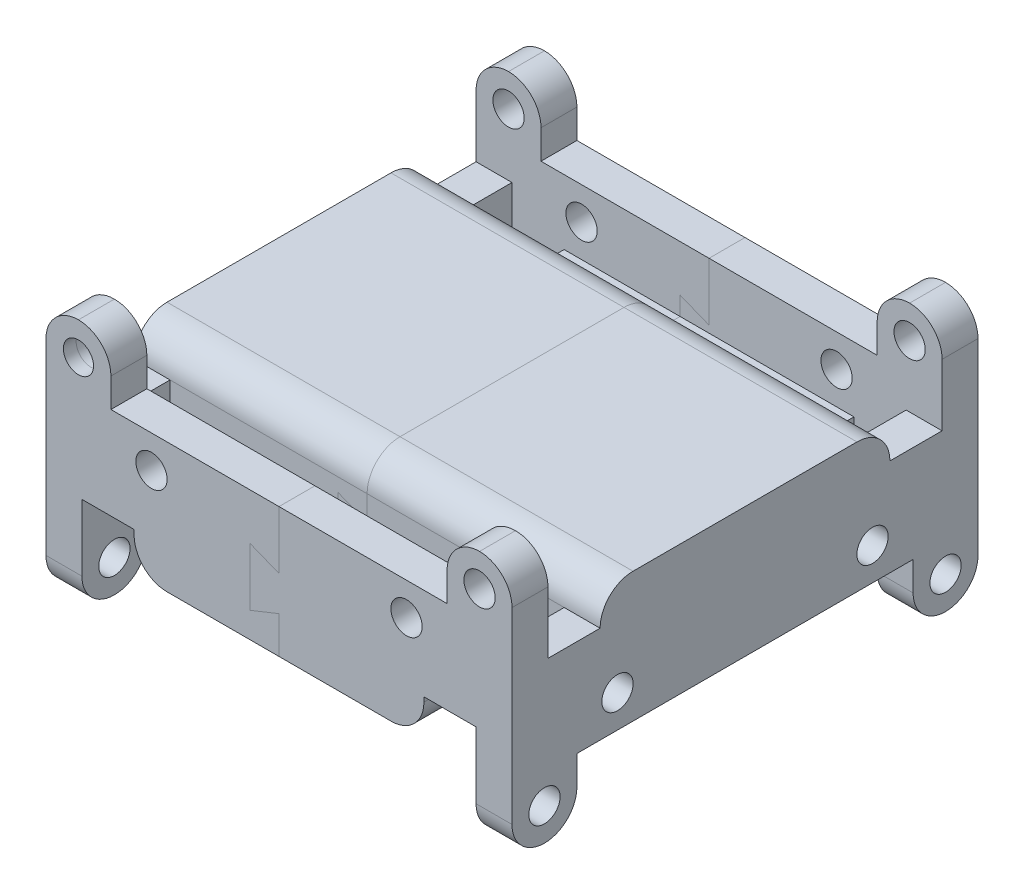
from build123d import *

# Parameters (mm, degrees)
ESBO_O1_R                  = 1.35
RESSALTO_EXTRUS_O1_DEPTH   = 2
ESBO_O3_W                  = 40.2
ESBO_O3_H                  = 2
RESSALTO_EXTRUS_O2_DEPTH   = 10.08
ESBO_O4_W                  = 3.1
ESBO_O4_H                  = 12.84
RESSALTO_EXTRUS_O3_DEPTH   = 34
CORTE_EXTRUS_O1_DEPTH      = 55.735280213
CORTE_EXTRUS_O1_DEPTH_BACK = 55.735280213
ESBO_O5_R                  = 1.35
ESBO_O7_W                  = 37.1
ESBO_O7_H                  = 3.24
CORTE_EXTRUS_O2_DEPTH      = 2
RESSALTO_EXTRUS_O5_START   = 2
ESBO_O12_R                 = 1.35
RESSALTO_EXTRUS_O5_DEPTH   = 2
ESBO_O18_W                 = 3.1
ESBO_O18_H                 = 3.24
RESSALTO_EXTRUS_O6_DEPTH   = 2
ESBO_O19_W                 = 3.1
ESBO_O19_H                 = 3.24
RESSALTO_EXTRUS_O7_DEPTH   = 2
ESBO_O21_R                 = 1.301764144
ESBO_O21_R_2               = 1.35
RESSALTO_EXTRUS_O8_DEPTH   = 1.1
RESSALTO_EXTRUS_O9_START   = 1.1
ESBO_O22_R                 = 1.35
RESSALTO_EXTRUS_O9_DEPTH   = 1.1
ESBO_O23_W                 = 3.1
ESBO_O23_H                 = 5.6
RESSALTO_EXTRUS_O10_DEPTH  = 5.85
CORTE_EXTRUS_O3_REACH      = 63.173
ESBO_O24_R                 = 1.35
ESBO_O25_W                 = 4.5
ESBO_O25_H                 = 3.1
CORTE_EXTRUS_O6_DEPTH      = 4.48
ESBO_O27_W                 = 3.1
ESBO_O27_H                 = 29
CORTE_EXTRUS_O7_DEPTH      = 4.48
ESBO_O28_W                 = 25
ESBO_O28_H                 = 40.2
CORTE_EXTRUS_O8_DEPTH      = 1.24
ESBO_O29_W                 = 25
ESBO_O29_H                 = 5.6
RESSALTO_EXTRUS_O11_DEPTH  = 34
ESBO_O31_W                 = 3.1
ESBO_O31_H                 = 25
RESSALTO_EXTRUS_O12_DEPTH  = 2.84
ESBO_O32_W                 = 25
ESBO_O32_H                 = 5.6
RESSALTO_EXTRUS_O13_DEPTH  = 34
FILETE1_R                  = 2.84
ESBO_O33_W                 = 5.6
ESBO_O33_H                 = 3.1
CORTE_EXTRUS_O9_DEPTH      = 0.55
ESBO_O35_W                 = 3.1
ESBO_O35_H                 = 5.6
CORTE_EXTRUS_O10_DEPTH     = 5.03
FILETE2_R                  = 2.8
DIVIDIR1_SURFACE_1_BACK    = 61.888
DIVIDIR1_SURFACE_1_DEPTH   = 123.776
DIVIDIR1_SURFACE_2_BACK    = 61.888
DIVIDIR1_SURFACE_2_DEPTH   = 123.776


with BuildPart() as part:
    # Esboço1 → Ressalto-extrusão1 (new body)
    with BuildSketch(Plane.XY):
        Polygon((0, 0), (5.6, 0), (5.6, -5.85), (34.6, -5.85), (34.6, 0), (40.2, 0), (40.2, -11.45), (0, -11.45), align=None)
        with Locations((2.8, -3.35)):
            Circle(ESBO_O1_R, mode=Mode.SUBTRACT)
        with Locations((37.4, -3.35)):
            Circle(ESBO_O1_R, mode=Mode.SUBTRACT)
        with Locations((31.1, -8.65)):
            Circle(ESBO_O1_R, mode=Mode.SUBTRACT)
        with Locations((9.1, -8.65)):
            Circle(ESBO_O1_R, mode=Mode.SUBTRACT)
    extrude(amount=RESSALTO_EXTRUS_O1_DEPTH)

    # Esboço3 → Ressalto-extrusão2 (add)
    with BuildSketch(Plane.XZ.offset(11.45)):
        with Locations((20.1, 1)):
            Rectangle(ESBO_O3_W, ESBO_O3_H)
    extrude(amount=RESSALTO_EXTRUS_O2_DEPTH)

    # Esboço4 → Ressalto-extrusão3 (add)
    with BuildSketch(Plane(origin=(0, 0, 0), x_dir=(-1, 0, 0), z_dir=(0, 0, -1))):
        with Locations((-38.65, -15.11)):
            Rectangle(ESBO_O4_W, ESBO_O4_H)
        with Locations((-1.55, -15.11)):
            Rectangle(ESBO_O4_W, ESBO_O4_H)
    extrude(amount=RESSALTO_EXTRUS_O3_DEPTH)

    # Esboço5 → Corte-extrusão1 (cut, two sides: drawn at the far end of the back side and taken through both)
    with BuildSketch(Plane.ZY.offset(-37.1).offset(-CORTE_EXTRUS_O1_DEPTH_BACK)):
        with Locations((-6, -14.25)):
            Circle(ESBO_O5_R)
        with Locations((-28, -14.25)):
            Circle(ESBO_O5_R)
    extrude(amount=CORTE_EXTRUS_O1_DEPTH + CORTE_EXTRUS_O1_DEPTH_BACK, mode=Mode.SUBTRACT)

    # Esboço7 → Corte-extrusão2 (cut)
    with BuildSketch(Plane(origin=(0, 0, 0), x_dir=(-1, 0, 0), z_dir=(0, 0, -1))):
        with Locations((-18.55, -19.91)):
            Rectangle(ESBO_O7_W, ESBO_O7_H)
    extrude(amount=-CORTE_EXTRUS_O2_DEPTH, mode=Mode.SUBTRACT)

    # Esboço12 → Ressalto-extrusão5 (add)
    with BuildSketch(Plane(origin=(0, 0, -34), x_dir=(-1, 0, 0), z_dir=(0, 0, -1)).offset(RESSALTO_EXTRUS_O5_START)):
        Polygon((-5.6, 0), (0, 0), (0, -18.29), (-40.2, -18.29), (-40.2, 0), (-34.6, 0), (-34.6, -5.85), (-5.6, -5.85), align=None)
        with Locations(Location((-31.1, -8.65, 0), (0, 0, 180))):
            Circle(ESBO_O12_R, mode=Mode.SUBTRACT)
        with Locations(Location((-9.1, -8.65, 0), (0, 0, 180))):
            Circle(ESBO_O12_R, mode=Mode.SUBTRACT)
        with Locations(Location((-2.8, -3.35, 0), (0, 0, 180))):
            Circle(ESBO_O12_R, mode=Mode.SUBTRACT)
        with Locations(Location((-37.4, -3.35, 0), (0, 0, 180))):
            Circle(ESBO_O12_R, mode=Mode.SUBTRACT)
    extrude(amount=-RESSALTO_EXTRUS_O5_DEPTH)

    # Esboço18 → Ressalto-extrusão6 (add)
    with BuildSketch(Plane.XY):
        with Locations((1.55, -19.91)):
            Rectangle(ESBO_O18_W, ESBO_O18_H)
    extrude(amount=RESSALTO_EXTRUS_O6_DEPTH)

    # Esboço19 → Ressalto-extrusão7 (add)
    with BuildSketch(Plane(origin=(0, 0, -34), x_dir=(-1, 0, 0), z_dir=(0, 0, -1))):
        with Locations((-1.55, -19.91)):
            Rectangle(ESBO_O19_W, ESBO_O19_H)
        with Locations((-38.65, -19.91)):
            Rectangle(ESBO_O19_W, ESBO_O19_H)
    extrude(amount=RESSALTO_EXTRUS_O7_DEPTH)

    # Esboço21 → Ressalto-extrusão8 (add)
    with BuildSketch(Plane.XY.offset(2)):
        Polygon((37.1, -21.53), (40.2, -21.53), (40.2, 0), (34.6, 0), (34.6, -5.85), (5.6, -5.85), (5.6, 0), (0, 0), (0, -21.53), (3.1, -21.53), (3.1, -18.29), (37.1, -18.29), align=None)
        with Locations((2.8, -3.35)):
            Circle(ESBO_O21_R, mode=Mode.SUBTRACT)
        with Locations((9.1, -8.65)):
            Circle(ESBO_O21_R_2, mode=Mode.SUBTRACT)
        with Locations((31.1, -8.65)):
            Circle(ESBO_O21_R_2, mode=Mode.SUBTRACT)
        with Locations((37.4, -3.35)):
            Circle(ESBO_O21_R_2, mode=Mode.SUBTRACT)
    extrude(amount=RESSALTO_EXTRUS_O8_DEPTH)

    # Esboço22 → Ressalto-extrusão9 (add)
    with BuildSketch(Plane(origin=(0, 0, -36), x_dir=(-1, 0, 0), z_dir=(0, 0, -1)).offset(RESSALTO_EXTRUS_O9_START)):
        Polygon((-5.6, 0), (0, 0), (0, -21.53), (-3.1, -21.53), (-3.1, -18.29), (-37.1, -18.29), (-37.1, -21.53), (-40.2, -21.53), (-40.2, 0), (-34.6, 0), (-34.6, -5.85), (-5.6, -5.85), align=None)
        with Locations(Location((-37.4, -3.35, 0), (0, 0, 180))):
            Circle(ESBO_O22_R, mode=Mode.SUBTRACT)
        with Locations(Location((-31.1, -8.65, 0), (0, 0, 180))):
            Circle(ESBO_O22_R, mode=Mode.SUBTRACT)
        with Locations(Location((-9.1, -8.65, 0), (0, 0, 180))):
            Circle(ESBO_O22_R, mode=Mode.SUBTRACT)
        with Locations(Location((-2.8, -3.35, 0), (0, 0, 180))):
            Circle(ESBO_O22_R, mode=Mode.SUBTRACT)
    extrude(amount=-RESSALTO_EXTRUS_O9_DEPTH)

    # Esboço23 → Ressalto-extrusão10 (add)
    with BuildSketch(Plane.XZ.offset(21.53)):
        with Locations((1.55, 0.3)):
            Rectangle(ESBO_O23_W, ESBO_O23_H)
        with Locations((1.55, -34.3)):
            Rectangle(ESBO_O23_W, ESBO_O23_H)
        with Locations((38.65, -34.3)):
            Rectangle(ESBO_O23_W, ESBO_O23_H)
        with Locations((38.65, 0.3)):
            Rectangle(ESBO_O23_W, ESBO_O23_H)
    extrude(amount=RESSALTO_EXTRUS_O10_DEPTH)

    # Corte-extrusão3: up to this face of the body (flat: up to its plane)
    corte_extrus_o3_end = Plane(part.part.faces().sort_by_distance((40.2, -15.177512698, -17))[0])
    # Esboço24 → Corte-extrusão3 (cut, up to the picked face)
    with BuildSketch(Plane.ZY, mode=Mode.PRIVATE) as corte_extrus_o3_sk1:
        with Locations(Location((-34.3, -19.55, 0), (0, 0, 270))):
            Circle(ESBO_O24_R)
    corte_extrus_o3_tool1 = split(extrude(corte_extrus_o3_sk1.sketch, amount=-CORTE_EXTRUS_O3_REACH, mode=Mode.PRIVATE), bisect_by=corte_extrus_o3_end, keep=Keep.BOTH, mode=Mode.PRIVATE)
    # Esboço24 → Corte-extrusão3 (cut, up to the picked face)
    with BuildSketch(Plane.ZY, mode=Mode.PRIVATE) as corte_extrus_o3_sk2:
        with Locations(Location((0.3, -19.55, 0), (0, 0, 270))):
            Circle(ESBO_O24_R)
    corte_extrus_o3_tool2 = split(extrude(corte_extrus_o3_sk2.sketch, amount=-CORTE_EXTRUS_O3_REACH, mode=Mode.PRIVATE), bisect_by=corte_extrus_o3_end, keep=Keep.BOTH, mode=Mode.PRIVATE)
    add(corte_extrus_o3_tool1.solids().sort_by(Axis((0, -19.55, -34.3), (1, 0, 0)))[0], mode=Mode.SUBTRACT)
    add(corte_extrus_o3_tool2.solids().sort_by(Axis((0, -19.55, 0.3), (1, 0, 0)))[0], mode=Mode.SUBTRACT)

    # Esboço25 → Corte-extrusão6 (cut)
    with BuildSketch(Plane.XZ.offset(18.29)):
        with Locations((5.35, -35.55)):
            Rectangle(ESBO_O25_W, ESBO_O25_H)
        with Locations((34.85, -35.55)):
            Rectangle(ESBO_O25_W, ESBO_O25_H)
        with Locations((34.85, 1.55)):
            Rectangle(ESBO_O25_W, ESBO_O25_H)
        with Locations((5.35, 1.55)):
            Rectangle(ESBO_O25_W, ESBO_O25_H)
    extrude(amount=-CORTE_EXTRUS_O6_DEPTH, mode=Mode.SUBTRACT)

    # Esboço27 → Corte-extrusão7 (cut)
    with BuildSketch(Plane.XZ.offset(21.53)):
        with Locations((1.55, -17)):
            Rectangle(ESBO_O27_W, ESBO_O27_H)
        with Locations((38.65, -17)):
            Rectangle(ESBO_O27_W, ESBO_O27_H)
    extrude(amount=-CORTE_EXTRUS_O7_DEPTH, mode=Mode.SUBTRACT)

    # Esboço28 → Corte-extrusão8 (cut)
    with BuildSketch(Plane.XZ.offset(18.29)):
        with Locations((20.1, -17)):
            Rectangle(ESBO_O28_W, ESBO_O28_H)
    extrude(amount=-CORTE_EXTRUS_O8_DEPTH, mode=Mode.SUBTRACT)

    # Esboço29 → Ressalto-extrusão11 (add)
    with BuildSketch(Plane.XY.offset(-34)):
        with Locations((20.1, -14.25)):
            Rectangle(ESBO_O29_W, ESBO_O29_H)
    extrude(amount=RESSALTO_EXTRUS_O11_DEPTH)

    # Esboço31 → Ressalto-extrusão12 (add)
    with BuildSketch(Plane(origin=(0, -8.69, 0), x_dir=(1, 0, 0), z_dir=(0, 1, 0))):
        with Locations((1.55, 17)):
            Rectangle(ESBO_O31_W, ESBO_O31_H)
        with Locations((38.65, 17)):
            Rectangle(ESBO_O31_W, ESBO_O31_H)
    extrude(amount=RESSALTO_EXTRUS_O12_DEPTH)

    # Esboço32 → Ressalto-extrusão13 (add)
    with BuildSketch(Plane.ZY.offset(-37.1)):
        with Locations((-17, -8.65)):
            Rectangle(ESBO_O32_W, ESBO_O32_H)
    extrude(amount=RESSALTO_EXTRUS_O13_DEPTH)

    # Filete1
    filete1_edges = [part.edges().sort_by_distance(p)[0] for p in [
        (32.6, -17.05, -17),
        (7.6, -17.05, -17),
        (20.1, -5.85, -29.5),
        (20.1, -5.85, -4.5),
    ]]
    fillet(filete1_edges, radius=FILETE1_R)

    # Esboço33 → Corte-extrusão9 (cut)
    with BuildSketch(Plane(origin=(0, 0, 0), x_dir=(1, 0, 0), z_dir=(0, 1, 0))):
        with Locations((2.8, 35.55)):
            Rectangle(ESBO_O33_W, ESBO_O33_H)
        with Locations((37.4, 35.55)):
            Rectangle(ESBO_O33_W, ESBO_O33_H)
        with Locations((37.4, -1.55)):
            Rectangle(ESBO_O33_W, ESBO_O33_H)
        with Locations((2.8, -1.55)):
            Rectangle(ESBO_O33_W, ESBO_O33_H)
    extrude(amount=-CORTE_EXTRUS_O9_DEPTH, mode=Mode.SUBTRACT)

    # Esboço35 → Corte-extrusão10 (cut)
    with BuildSketch(Plane.XZ.offset(27.38)):
        with Locations((1.55, 0.3)):
            Rectangle(ESBO_O35_W, ESBO_O35_H)
        with Locations((38.65, 0.3)):
            Rectangle(ESBO_O35_W, ESBO_O35_H)
        with Locations((38.65, -34.3)):
            Rectangle(ESBO_O35_W, ESBO_O35_H)
        with Locations((1.55, -34.3)):
            Rectangle(ESBO_O35_W, ESBO_O35_H)
    extrude(amount=-CORTE_EXTRUS_O10_DEPTH, mode=Mode.SUBTRACT)

    # Filete2
    filete2_edges = [part.edges().sort_by_distance(p)[0] for p in [
        (34.6, -0.55, 1.55),
        (40.2, -0.55, 1.55),
        (0, -0.55, 1.55),
        (5.6, -0.55, 1.55),
        (40.2, -0.55, -35.55),
        (34.6, -0.55, -35.55),
        (5.6, -0.55, -35.55),
        (0, -0.55, -35.55),
        (1.55, -22.35, -31.5),
        (1.55, -22.35, -37.1),
        (38.65, -22.35, -31.5),
        (38.65, -22.35, -37.1),
        (38.65, -22.35, 3.1),
        (38.65, -22.35, -2.5),
        (1.55, -22.35, -2.5),
        (1.55, -22.35, 3.1),
    ]]
    fillet(filete2_edges, radius=FILETE2_R - 0.0001)  # a hair under: the kernel refuses the full size


with BuildPart() as body_2:
    # Dividir1: the piece behind the surface
    add(part.part)
    # Dividir1 surface: a surface, the sketch's curves swept straight by 123.776 mm
    with BuildLine(Plane.XY.offset(3.1).offset(-DIVIDIR1_SURFACE_1_BACK), mode=Mode.PRIVATE) as dividir1_surface_1_path:
        Line((20.1, -0.55), (20.1, -10.85))
        Line((20.1, -10.85), (17.6, -9.85))
        Line((17.6, -9.85), (17.6, -14.85))
        Line((17.6, -14.85), (20.1, -13.85))
        Line((20.1, -13.85), (20.1, -22.35))
    dividir1_surface_1 = Shell.extrude(dividir1_surface_1_path.wire(), (0 * DIVIDIR1_SURFACE_1_DEPTH, 0 * DIVIDIR1_SURFACE_1_DEPTH, 1 * DIVIDIR1_SURFACE_1_DEPTH))
    split(bisect_by=dividir1_surface_1, keep=Keep.BOTTOM)


with BuildPart() as part_1:
    add(part.part)

    # Dividir1: split by a surface, the side it looks to stays
    # Dividir1 surface: a surface, the sketch's curves swept straight by 123.776 mm
    with BuildLine(Plane.XY.offset(3.1).offset(-DIVIDIR1_SURFACE_2_BACK), mode=Mode.PRIVATE) as dividir1_surface_2_path:
        Line((20.1, -0.55), (20.1, -10.85))
        Line((20.1, -10.85), (17.6, -9.85))
        Line((17.6, -9.85), (17.6, -14.85))
        Line((17.6, -14.85), (20.1, -13.85))
        Line((20.1, -13.85), (20.1, -22.35))
    dividir1_surface_2 = Shell.extrude(dividir1_surface_2_path.wire(), (0 * DIVIDIR1_SURFACE_2_DEPTH, 0 * DIVIDIR1_SURFACE_2_DEPTH, 1 * DIVIDIR1_SURFACE_2_DEPTH))
    split(bisect_by=dividir1_surface_2, keep=Keep.TOP)


solid = Compound([body_2.part, part_1.part])
